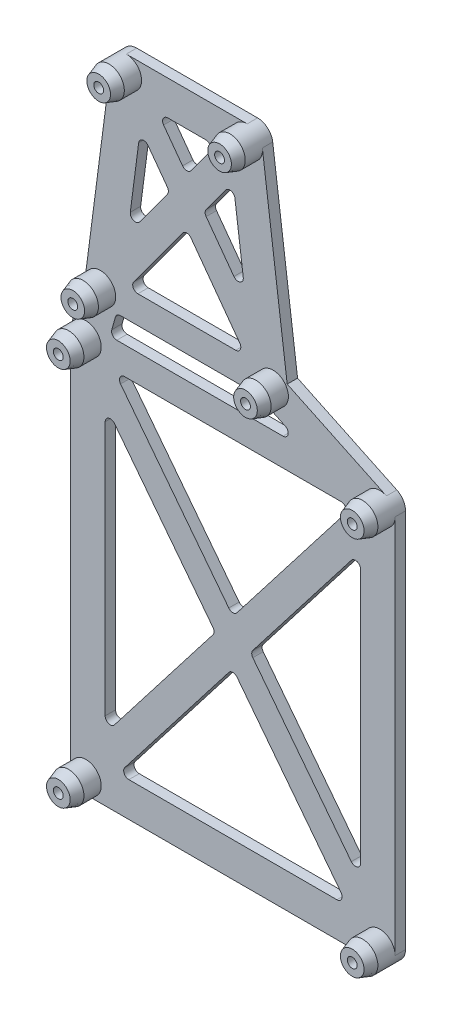
from build123d import *
from OCP.BRepFilletAPI import BRepFilletAPI_MakeChamfer

# Parameters (mm, degrees)
BOSS_EXTRUDE1_START       = -3
BOSS_EXTRUDE1_OUTLINE_R   = 1.425
BOSS_EXTRUDE1_DEPTH       = 3
CUT_EXTRUDE1_DEPTH        = 141.259282224
FILLET1_R                 = 5
BOSS_EXTRUDE2_START       = -3
BOSS_EXTRUDE2_DEPTH       = 3
BOSS_EXTRUDE3_OUTLINE_R   = 4.425
BOSS_EXTRUDE3_OUTLINE_R_2 = 1.425
BOSS_EXTRUDE3_DEPTH       = 8
CHAMFER1_SIZE             = 3
CHAMFER1_SIZE2            = 1
FILLET2_R                 = 1.5


with BuildPart() as part:
    # Boss-Extrude1: read off the stored shape, not the designer's step
    # Boss-Extrude1 outline → Boss-Extrude1 (new body)
    with BuildSketch(Plane.XY.offset(BOSS_EXTRUDE1_START)):
        with BuildLine():
            Line((46.975, -55), (46.975, 55))
            ThreePointArc((46.975, 55), (46.291006282, 57.363365609), (44.450481582, 58.996097441))
            Line((44.450481582, 58.996097441), (15.719744672, 72.659987561))
            Line((15.719744672, 72.659987561), (8.529121486, 128.267473535))
            ThreePointArc((8.529121486, 128.267473535), (7.062093597, 131.023529403), (4.140659479, 132.125))
            Line((4.140659479, 132.125), (-30.859340521, 132.125))
            ThreePointArc((-30.859340521, 132.125), (-33.988288028, 130.828947507), (-35.284340521, 127.7))
            Line((-35.284340521, 127.7), (-42.705029635, 70.596624539))
            Line((-42.705029635, 70.596624539), (-46.805456987, 56.213140895))
            ThreePointArc((-46.805456987, 56.213140895), (-46.932409278, 55.612465441), (-46.975, 55))
            Line((-46.975, 55), (-46.975, -55))
            ThreePointArc((-46.975, -55), (-45.678947507, -58.128947507), (-42.55, -59.425))
            Line((-42.55, -59.425), (42.55, -59.425))
            ThreePointArc((42.55, -59.425), (45.678947507, -58.128947507), (46.975, -55))
        make_face()
        with Locations((-42.55, -55)):
            Circle(BOSS_EXTRUDE1_OUTLINE_R, mode=Mode.SUBTRACT)
        with Locations((42.55, -55)):
            Circle(BOSS_EXTRUDE1_OUTLINE_R, mode=Mode.SUBTRACT)
        with Locations((-42.55, 55)):
            Circle(BOSS_EXTRUDE1_OUTLINE_R, mode=Mode.SUBTRACT)
        with Locations((-38.359340521, 69.7)):
            Circle(BOSS_EXTRUDE1_OUTLINE_R, mode=Mode.SUBTRACT)
        with Locations((-30.859340521, 127.7)):
            Circle(BOSS_EXTRUDE1_OUTLINE_R, mode=Mode.SUBTRACT)
        with Locations((11.640659479, 69.7)):
            Circle(BOSS_EXTRUDE1_OUTLINE_R, mode=Mode.SUBTRACT)
        with Locations((42.55, 55)):
            Circle(BOSS_EXTRUDE1_OUTLINE_R, mode=Mode.SUBTRACT)
        with Locations((4.140659479, 127.7)):
            Circle(BOSS_EXTRUDE1_OUTLINE_R, mode=Mode.SUBTRACT)
    extrude(amount=BOSS_EXTRUDE1_DEPTH)

    # Sketch2 → Cut-Extrude1 (cut, through all)
    with BuildSketch(Plane.XY):
        Polygon((36.975, -49.425), (36.975, 51.478016268), (6.501473049, 65.970750135), (-0.759852365, 122.125), (-25.924738161, 122.125), (-32.884263276, 68.570354395), (-36.975, 54.220863544), (-36.975, -49.425), align=None)
    extrude(amount=-CUT_EXTRUDE1_DEPTH, mode=Mode.SUBTRACT)

    # Fillet1
    fillet1_edges = [part.edges().sort_by_distance(p)[0] for p in [
        (36.975, -49.425, -1.5),
        (-36.975, -49.425, -1.5),
        (-36.975, 54.220863544, -1.5),
        (-32.884263276, 68.570354395, -1.5),
        (-25.924738161, 122.125, -1.5),
        (-0.759852365, 122.125, -1.5),
        (6.501473049, 65.970750135, -1.5),
        (36.975, 51.478016268, -1.5),
    ]]
    fillet(fillet1_edges, radius=FILLET1_R)

    # Sketch3 → Boss-Extrude2 (add)
    with BuildSketch(Plane.XY.offset(BOSS_EXTRUDE2_START)):
        with BuildLine():
            Line((-13.359340521, 110.585124752), (-8.400412901, 103.817647059))
            Line((-8.400412901, 103.817647059), (0.106294158, 115.426800222))
            Line((0.106294158, 115.426800222), (-0.196216119, 117.766213034))
            ThreePointArc((-0.196216119, 117.766213034), (-1.762074631, 120.797673514), (-4.907872753, 122.118892529))
            Line((-4.907872753, 122.118892529), (-13.359340521, 110.585124752))
        make_face()
        Polygon((-18.318268141, 103.817647059), (-13.359340521, 97.050169366), (-8.400412901, 103.817647059), (-13.359340521, 110.585124752), align=None)
        Polygon((-30.456475647, 87.252563875), (-32.217656355, 73.7), (-30.469378419, 73.7), (-13.359340521, 97.050169366), (-18.318268141, 103.817647059), align=None)
        with BuildLine():
            Line((-26.490764046, 117.769341361), (-26.799669466, 115.392265338))
            Line((-26.799669466, 115.392265338), (-18.318268141, 103.817647059))
            Line((-18.318268141, 103.817647059), (-13.359340521, 110.585124752))
            Line((-13.359340521, 110.585124752), (-21.809649014, 122.117310459))
            ThreePointArc((-21.809649014, 122.117310459), (-24.935223371, 120.788491562), (-26.490764046, 117.769341361))
        make_face()
        Polygon((3.750697376, 73.7), (5.502001083, 73.7), (3.752025755, 87.233142539), (-8.400412901, 103.817647059), (-13.359340521, 97.050169366), align=None)
        Polygon((-32.217656355, 73.7), (-32.594546524, 70.799770586), (-30.469378419, 73.7), align=None)
        with BuildLine():
            Line((-32.986220482, 68.212708794), (-33.702540681, 65.7))
            Line((-33.702540681, 65.7), (7.656754768, 65.7))
            ThreePointArc((7.656754768, 65.7), (6.649193532, 67.057986899), (6.151894728, 68.674155814))
            Line((6.151894728, 68.674155814), (5.877280449, 70.797839571))
            Line((5.877280449, 70.797839571), (3.750697376, 73.7))
            Line((3.750697376, 73.7), (-30.469378419, 73.7))
            Line((-30.469378419, 73.7), (-32.594546524, 70.799770586))
            Line((-32.594546524, 70.799770586), (-32.836337852, 68.939148105))
            ThreePointArc((-32.836337852, 68.939148105), (-32.897789852, 68.573145266), (-32.986220482, 68.212708794))
        make_face()
        Polygon((3.750697376, 73.7), (5.877280449, 70.797839571), (5.502001083, 73.7), align=None)
        with BuildLine():
            ThreePointArc((-36.783425974, 54.892867127), (-36.862088643, 54.578668017), (-36.920243348, 54.260035115))
            Line((-36.920243348, 54.260035115), (-34.398161636, 51))
            Line((-34.398161636, 51), (34.398161636, 51))
            Line((34.398161636, 51), (35.248308123, 52.098896751))
            ThreePointArc((35.248308123, 52.098896751), (34.710224384, 52.504802867), (34.122436816, 52.834650803))
            Line((34.122436816, 52.834650803), (21.158703634, 59))
            Line((21.158703634, 59), (-35.61256915, 59))
            Line((-35.61256915, 59), (-36.783425974, 54.892867127))
        make_face()
        with BuildLine():
            Line((36.195636792, 51), (34.398161636, 51))
            Line((34.398161636, 51), (0, 6.537041363))
            Line((0, 6.537041363), (5.057292909, 0))
            Line((5.057292909, 0), (36.975, 41.25673067))
            Line((36.975, 41.25673067), (36.975, 48.319286463))
            ThreePointArc((36.975, 48.319286463), (36.776207346, 49.71514033), (36.195636792, 51))
        make_face()
        Polygon((-34.398161636, 51), (-36.975, 51), (-36.975, 41.25673067), (-5.057292909, 0), (0, 6.537041363), align=None)
        with BuildLine():
            ThreePointArc((-36.920243348, 54.260035115), (-36.961292046, 53.892075142), (-36.975, 53.522086454))
            Line((-36.975, 53.522086454), (-36.975, 51))
            Line((-36.975, 51), (-34.398161636, 51))
            Line((-34.398161636, 51), (-36.920243348, 54.260035115))
        make_face()
        with BuildLine():
            Line((35.248308123, 52.098896751), (34.398161636, 51))
            Line((34.398161636, 51), (36.195636792, 51))
            ThreePointArc((36.195636792, 51), (35.762043189, 51.583992251), (35.248308123, 52.098896751))
        make_face()
        with BuildLine():
            Line((5.057292909, 0), (0, -6.537041363))
            Line((0, -6.537041363), (33.08343567, -49.300589233))
            ThreePointArc((33.08343567, -49.300589233), (35.882824097, -47.544120201), (36.975, -44.425))
            Line((36.975, -44.425), (36.975, -41.25673067))
            Line((36.975, -41.25673067), (5.057292909, 0))
        make_face()
        with BuildLine():
            Line((-5.057292909, 0), (-36.975, -41.25673067))
            Line((-36.975, -41.25673067), (-36.975, -44.425))
            ThreePointArc((-36.975, -44.425), (-35.882824097, -47.544120201), (-33.08343567, -49.300589233))
            Line((-33.08343567, -49.300589233), (0, -6.537041363))
            Line((0, -6.537041363), (-5.057292909, 0))
        make_face()
        Polygon((0, 6.537041363), (-5.057292909, 0), (0, -6.537041363), (5.057292909, 0), align=None)
    extrude(amount=BOSS_EXTRUDE2_DEPTH)

    # Boss-Extrude3: read off the stored shape, not the designer's step
    # Boss-Extrude3 outline → Boss-Extrude3 (add)
    # profile 1 of 8: a face of its own
    with BuildSketch(Plane.XY):
        with Locations((42.55, -55)):
            Circle(BOSS_EXTRUDE3_OUTLINE_R)
        with Locations((42.55, -55)):
            Circle(BOSS_EXTRUDE3_OUTLINE_R_2, mode=Mode.SUBTRACT)
    # profile 2 of 8: a face of its own
    with BuildSketch(Plane.XY):
        with Locations((-42.55, -55)):
            Circle(BOSS_EXTRUDE3_OUTLINE_R)
        with Locations((-42.55, -55)):
            Circle(BOSS_EXTRUDE3_OUTLINE_R_2, mode=Mode.SUBTRACT)
    # profile 3 of 8: a face of its own
    with BuildSketch(Plane.XY):
        with Locations((-42.55, 55)):
            Circle(BOSS_EXTRUDE3_OUTLINE_R)
        with Locations((-42.55, 55)):
            Circle(BOSS_EXTRUDE3_OUTLINE_R_2, mode=Mode.SUBTRACT)
    # profile 4 of 8: a face of its own
    with BuildSketch(Plane.XY):
        with Locations((-30.859340521, 127.7)):
            Circle(BOSS_EXTRUDE3_OUTLINE_R)
        with Locations((-30.859340521, 127.7)):
            Circle(BOSS_EXTRUDE3_OUTLINE_R_2, mode=Mode.SUBTRACT)
    # profile 5 of 8: a face of its own
    with BuildSketch(Plane.XY):
        with Locations((4.140659479, 127.7)):
            Circle(BOSS_EXTRUDE3_OUTLINE_R)
        with Locations((4.140659479, 127.7)):
            Circle(BOSS_EXTRUDE3_OUTLINE_R_2, mode=Mode.SUBTRACT)
    # profile 6 of 8: a face of its own
    with BuildSketch(Plane.XY):
        with Locations((42.55, 55)):
            Circle(BOSS_EXTRUDE3_OUTLINE_R)
        with Locations((42.55, 55)):
            Circle(BOSS_EXTRUDE3_OUTLINE_R_2, mode=Mode.SUBTRACT)
    # profile 7 of 8: a face of its own
    with BuildSketch(Plane.XY):
        with Locations((11.640659479, 69.7)):
            Circle(BOSS_EXTRUDE3_OUTLINE_R)
        with Locations((11.640659479, 69.7)):
            Circle(BOSS_EXTRUDE3_OUTLINE_R_2, mode=Mode.SUBTRACT)
    # profile 8 of 8: a face of its own
    with BuildSketch(Plane.XY):
        with Locations((-38.359340521, 69.7)):
            Circle(BOSS_EXTRUDE3_OUTLINE_R)
        with Locations((-38.359340521, 69.7)):
            Circle(BOSS_EXTRUDE3_OUTLINE_R_2, mode=Mode.SUBTRACT)
    extrude(amount=BOSS_EXTRUDE3_DEPTH)

    # Chamfer1: one chamfer whose edges measure the first distance from different faces: ONE call of the kernel's chamfer builder (chamfer() names one face for all edges)
    chamfer1_edges_1 = [part.edges().sort_by_distance(p)[0] for p in [
        (-35.284340521, 127.7, 8),
    ]]
    chamfer1_side_1 = [part.faces().sort_by_distance(p)[0] for p in [
        (-35.284340521, 127.7, 4),
    ]]
    chamfer1_edges_2 = [part.edges().sort_by_distance(p)[0] for p in [
        (-0.284340521, 127.7, 8),
    ]]
    chamfer1_side_2 = [part.faces().sort_by_distance(p)[0] for p in [
        (-0.284340521, 127.7, 4),
    ]]
    chamfer1_edges_3 = [part.edges().sort_by_distance(p)[0] for p in [
        (7.215659479, 69.7, 8),
    ]]
    chamfer1_side_3 = [part.faces().sort_by_distance(p)[0] for p in [
        (7.215659479, 69.7, 4),
    ]]
    chamfer1_edges_4 = [part.edges().sort_by_distance(p)[0] for p in [
        (-42.784340521, 69.7, 8),
    ]]
    chamfer1_side_4 = [part.faces().sort_by_distance(p)[0] for p in [
        (-42.784340521, 69.7, 4),
    ]]
    chamfer1_edges_5 = [part.edges().sort_by_distance(p)[0] for p in [
        (-46.975, 55, 8),
    ]]
    chamfer1_side_5 = [part.faces().sort_by_distance(p)[0] for p in [
        (-46.975, 55, 4),
    ]]
    chamfer1_edges_6 = [part.edges().sort_by_distance(p)[0] for p in [
        (38.125, 55, 8),
    ]]
    chamfer1_side_6 = [part.faces().sort_by_distance(p)[0] for p in [
        (38.125, 55, 4),
    ]]
    chamfer1_edges_7 = [part.edges().sort_by_distance(p)[0] for p in [
        (38.125, -55, 8),
    ]]
    chamfer1_side_7 = [part.faces().sort_by_distance(p)[0] for p in [
        (38.125, -55.000000001, 4),
    ]]
    chamfer1_edges_8 = [part.edges().sort_by_distance(p)[0] for p in [
        (-46.975, -55, 8),
    ]]
    chamfer1_side_8 = [part.faces().sort_by_distance(p)[0] for p in [
        (-46.975, -55, 4),
    ]]
    chamfer1 = BRepFilletAPI_MakeChamfer(part.part.solid().wrapped)
    for e in chamfer1_edges_1:
        chamfer1.Add(CHAMFER1_SIZE, CHAMFER1_SIZE2, e.wrapped, chamfer1_side_1[0].wrapped)  # the first distance lies on this face
    for e in chamfer1_edges_2:
        chamfer1.Add(CHAMFER1_SIZE, CHAMFER1_SIZE2, e.wrapped, chamfer1_side_2[0].wrapped)  # the first distance lies on this face
    for e in chamfer1_edges_3:
        chamfer1.Add(CHAMFER1_SIZE, CHAMFER1_SIZE2, e.wrapped, chamfer1_side_3[0].wrapped)  # the first distance lies on this face
    for e in chamfer1_edges_4:
        chamfer1.Add(CHAMFER1_SIZE, CHAMFER1_SIZE2, e.wrapped, chamfer1_side_4[0].wrapped)  # the first distance lies on this face
    for e in chamfer1_edges_5:
        chamfer1.Add(CHAMFER1_SIZE, CHAMFER1_SIZE2, e.wrapped, chamfer1_side_5[0].wrapped)  # the first distance lies on this face
    for e in chamfer1_edges_6:
        chamfer1.Add(CHAMFER1_SIZE, CHAMFER1_SIZE2, e.wrapped, chamfer1_side_6[0].wrapped)  # the first distance lies on this face
    for e in chamfer1_edges_7:
        chamfer1.Add(CHAMFER1_SIZE, CHAMFER1_SIZE2, e.wrapped, chamfer1_side_7[0].wrapped)  # the first distance lies on this face
    for e in chamfer1_edges_8:
        chamfer1.Add(CHAMFER1_SIZE, CHAMFER1_SIZE2, e.wrapped, chamfer1_side_8[0].wrapped)  # the first distance lies on this face
    add(Compound.cast(chamfer1.Shape()), mode=Mode.REPLACE)

    # Fillet2
    # the kernel refuses this fillet: 1.5 mm, written as the material it adds along each edge
    with BuildSketch(Plane(origin=(36.975, -41.25673067, -3), x_dir=(0, 1, 0), z_dir=(0, 0, 1)), Plane(origin=(-36.975, 41.25673067, -3), x_dir=(0, -1, 0), z_dir=(0, 0, 1))) as fillet2_piece_1:
        with BuildLine():
            CenterArc((FILLET2_R * 2.92685728561, FILLET2_R), FILLET2_R, 127.726839505, 142.273160495)
            Line((FILLET2_R * 2.31495967357, FILLET2_R * 1.79093698383), (0, 0))
            Line((0, 0), (FILLET2_R * 2.92685728561, 0))
        make_face()
    extrude(amount=3)
    with BuildSketch(Plane(origin=(33.08343567, -49.300589233, -3), x_dir=(-0.9991182911759181, -0.04198380923300266, 0), z_dir=(0, 0, 1))) as fillet2_piece_2:
        with BuildLine():
            CenterArc((2.90032775, -1.498677437), FILLET2_R, 87.593797692, 127.726839505)
            Line((1.676433649, -2.36590476), (1.554044239, -2.452627493))
            Line((1.554044239, -2.452627493), (-0.12238941, -0.086722732))
            Line((-0.12238941, -0.086722732), (-0.027082876, 0.147534802))
            ThreePointArc((-0.027082876, 0.147534802), (1.118979162, 0.227632465), (2.969601035, 0.149867744))
            Line((2.969601035, 0.149867744), (2.963303464, 0))
        make_face()
    extrude(amount=3)
    with BuildSketch(Plane(origin=(0, -6.537041363, -3), x_dir=(0.6118976120341761, -0.7909369838279613, 0), z_dir=(0, 0, 1)), Plane(origin=(0, 6.537041363, -3), x_dir=(-0.6118976120341769, 0.7909369838279607, 0), z_dir=(0, 0, 1))) as fillet2_piece_3:
        with BuildLine():
            CenterArc((FILLET2_R * 1.29259694477, -FILLET2_R), FILLET2_R, 90, 104.54632099)
            Line((FILLET2_R * 0.324652041423, -FILLET2_R * 1.25116262477), (0, 0))
            Line((0, 0), (FILLET2_R * 1.29259694477, 0))
        make_face()
    extrude(amount=3)
    with BuildSketch(Plane(origin=(-33.08343567, -49.300589233, -3), x_dir=(0.6118976120341917, 0.7909369838279493, 0), z_dir=(0, 0, 1))) as fillet2_piece_4:
        with BuildLine():
            CenterArc((2.899643964, -1.5), FILLET2_R, 90, 127.726839505)
            Line((1.713238488, -2.417846418), (1.59459794, -2.50963106))
            ThreePointArc((1.59459794, -2.50963106), (0.461207515, -1.044614059), (-0.136035989, -0.063199759))
            Line((-0.136035989, -0.063199759), (0, 0.15))
            Line((0, 0.15), (2.899643964, 0.15))
            Line((2.899643964, 0.15), (2.899643964, 0))
        make_face()
    extrude(amount=3)
    with BuildSketch(Plane(origin=(-36.975, -41.25673067, -3), x_dir=(0, 1, 0), z_dir=(0, 0, 1)), Plane(origin=(36.975, 41.25673067, -3), x_dir=(0, -1, 0), z_dir=(0, 0, 1))) as fillet2_piece_5:
        with BuildLine():
            CenterArc((FILLET2_R * 2.92685728561, -FILLET2_R), FILLET2_R, 90, 142.273160495)
            Line((FILLET2_R * 2.31495967357, -FILLET2_R * 1.79093698383), (0, 0))
            Line((0, 0), (FILLET2_R * 2.92685728561, 0))
        make_face()
    extrude(amount=3)
    with BuildSketch(Plane(origin=(-5.057292909, 0, -3), x_dir=(-0.6118976120341743, 0.7909369838279628, 0), z_dir=(0, 0, 1)), Plane(origin=(5.057292909, 0, -3), x_dir=(0.611897612034178, -0.7909369838279598, 0), z_dir=(0, 0, 1))) as fillet2_piece_6:
        with BuildLine():
            CenterArc((FILLET2_R * 0.773636363636, FILLET2_R), FILLET2_R, 194.54632099, 75.45367901)
            Line((-FILLET2_R * 0.194308539711, FILLET2_R * 0.748837375226), (0, 0))
            Line((0, 0), (FILLET2_R * 0.773636363636, 0))
        make_face()
    extrude(amount=3)
    with BuildSketch(Plane(origin=(-34.398161636, 51, -3), x_dir=(0.611897612034177, -0.7909369838279607, 0), z_dir=(0, 0, 1))) as fillet2_piece_7:
        with BuildLine():
            CenterArc((FILLET2_R * 2.03795959096, FILLET2_R), FILLET2_R, 142.273160495, 127.726839505)
            Line((FILLET2_R * 1.24702260713, FILLET2_R * 1.61189761203), (0, 0))
            Line((0, 0), (FILLET2_R * 2.03795959096, 0))
        make_face()
    extrude(amount=3)
    with BuildSketch(Plane(origin=(34.398161636, 51, -3), x_dir=(-0.6118976120341773, -0.7909369838279604, 0), z_dir=(0, 0, 1))) as fillet2_piece_8:
        with BuildLine():
            CenterArc((FILLET2_R * 2.03795959096, -FILLET2_R), FILLET2_R, 90, 127.726839505)
            Line((FILLET2_R * 1.24702260713, -FILLET2_R * 1.61189761203), (0, 0))
            Line((0, 0), (FILLET2_R * 2.03795959096, 0))
        make_face()
    extrude(amount=3)
    with BuildSketch(Plane(origin=(21.158703634, 59, -3), x_dir=(-0.9030728679592901, 0.4294873632084912, 0), z_dir=(0, 0, 1))) as fillet2_piece_9:
        with BuildLine():
            CenterArc((FILLET2_R * 4.43103343889, FILLET2_R), FILLET2_R, 115.435031326, 154.564968674)
            Line((FILLET2_R * 4.00154607569, FILLET2_R * 1.90307286796), (0, 0))
            Line((0, 0), (FILLET2_R * 4.43103343889, 0))
        make_face()
    extrude(amount=3)
    with BuildSketch(Plane(origin=(7.656754768, 65.7, -3), x_dir=(0.7559277616775966, -0.6546550382645037, 0), z_dir=(0, 0, 1))) as fillet2_piece_10:
        with BuildLine():
            CenterArc((0.561302952, -1.498212199), FILLET2_R, 92.797658541, 38.095839762)
            Line((-0.420679605, -0.364320557), (0, 0))
            ThreePointArc((0, 0), (0.244044762, -0.005959336), (0.488089524, 0))
        make_face()
    extrude(amount=3)
    with BuildSketch(Plane(origin=(-35.61256915, 59, -3), x_dir=(1, 0, 0), z_dir=(0, 0, 1))) as fillet2_piece_11:
        with BuildLine():
            CenterArc((FILLET2_R * 1.32492019361, FILLET2_R), FILLET2_R, 164.08826839, 105.91173161)
            Line((FILLET2_R * 0.363234998803, FILLET2_R * 1.2741561345), (0, 0))
            Line((0, 0), (FILLET2_R * 1.32492019361, 0))
        make_face()
    extrude(amount=3)
    with BuildSketch(Plane(origin=(-33.702540681, 65.7, -3), x_dir=(-0.274156134500953, -0.961685194809349, 0), z_dir=(0, 0, 1))) as fillet2_piece_12:
        with BuildLine():
            CenterArc((FILLET2_R * 0.754762441407, FILLET2_R), FILLET2_R, 195.91173161, 74.08826839)
            Line((-FILLET2_R * 0.206922753403, FILLET2_R * 0.725843865499), (0, 0))
            Line((0, 0), (FILLET2_R * 0.754762441407, 0))
        make_face()
    extrude(amount=3)
    with BuildSketch(Plane(origin=(-30.469378419, 73.7, -3), x_dir=(1, 0, 0), z_dir=(0, 0, 1))) as fillet2_piece_13:
        with BuildLine():
            CenterArc((FILLET2_R * 1.97249052566, FILLET2_R), FILLET2_R, 143.767581245, 126.232418755)
            Line((FILLET2_R * 1.16586451564, FILLET2_R * 1.59106216252), (0, 0))
            Line((0, 0), (FILLET2_R * 1.97249052566, 0))
        make_face()
    extrude(amount=3)
    with BuildSketch(Plane(origin=(3.750697376, 73.7, -3), x_dir=(-1, 0, 0), z_dir=(0, 0, 1))) as fillet2_piece_14:
        with BuildLine():
            CenterArc((FILLET2_R * 1.97249052566, -FILLET2_R), FILLET2_R, 90, 126.232418755)
            Line((FILLET2_R * 1.16586451564, -FILLET2_R * 1.59106216252), (0, 0))
            Line((0, 0), (FILLET2_R * 1.97249052566, 0))
        make_face()
    extrude(amount=3)
    with BuildSketch(Plane(origin=(-13.359340521, 97.050169366, -3), x_dir=(0.5910621625154567, -0.8066260100210951, 0), z_dir=(0, 0, 1))) as fillet2_piece_15:
        with BuildLine():
            CenterArc((FILLET2_R * 1.36470588235, -FILLET2_R), FILLET2_R, 90, 107.535162489)
            Line((FILLET2_R * 0.411173654704, -FILLET2_R * 1.30129104009), (0, 0))
            Line((0, 0), (FILLET2_R * 1.36470588235, 0))
        make_face()
    extrude(amount=3)
    with BuildSketch(Plane(origin=(3.752025755, 87.233142539, -3), x_dir=(-0.12824260686651673, 0.9917428264343937, 0), z_dir=(0, 0, 1))) as fillet2_piece_16:
        with BuildLine():
            CenterArc((FILLET2_R * 3.88568031429, FILLET2_R), FILLET2_R, 118.864367684, 151.135632316)
            Line((FILLET2_R * 3.40294247693, FILLET2_R * 1.87576491159), (0, 0))
            Line((0, 0), (FILLET2_R * 3.88568031429, 0))
        make_face()
    extrude(amount=3)
    with BuildSketch(Plane(origin=(-8.400412901, 103.817647059, -3), x_dir=(0.5910621625154552, -0.8066260100210961, 0), z_dir=(0, 0, 1)), Plane(origin=(-18.318268141, 103.817647059, -3), x_dir=(-0.5910621625154587, 0.8066260100210937, 0), z_dir=(0, 0, 1))) as fillet2_piece_17:
        with BuildLine():
            CenterArc((FILLET2_R * 0.73275862069, FILLET2_R), FILLET2_R, 197.535162489, 72.464837511)
            Line((-FILLET2_R * 0.220773606959, FILLET2_R * 0.698708959915), (0, 0))
            Line((0, 0), (FILLET2_R * 0.73275862069, 0))
        make_face()
    extrude(amount=3)
    with BuildSketch(Plane(origin=(0.106294158, 115.426800222, -3), x_dir=(0.12824260686651523, -0.991742826434394, 0), z_dir=(0, 0, 1))) as fillet2_piece_18:
        with BuildLine():
            CenterArc((FILLET2_R * 2.5001486338, -FILLET2_R), FILLET2_R, 90, 136.399530173)
            Line((FILLET2_R * 1.81052315186, -FILLET2_R * 1.72416620651), (0, 0))
            Line((0, 0), (FILLET2_R * 2.5001486338, 0))
        make_face()
    extrude(amount=3)
    with BuildSketch(Plane(origin=(-30.456475647, 87.252563875, -3), x_dir=(0.1288682722639774, 0.9916617207514351, 0), z_dir=(0, 0, 1))) as fillet2_piece_19:
        with BuildLine():
            CenterArc((FILLET2_R * 3.89076482555, -FILLET2_R), FILLET2_R, 90, 151.171780247)
            Line((FILLET2_R * 3.40857960467, -FILLET2_R * 1.87606929678), (0, 0))
            Line((0, 0), (FILLET2_R * 3.89076482555, 0))
        make_face()
    extrude(amount=3)
    with BuildSketch(Plane(origin=(-26.799669466, 115.392265338, -3), x_dir=(-0.12886827226397635, -0.9916617207514352, 0), z_dir=(0, 0, 1))) as fillet2_piece_20:
        with BuildLine():
            CenterArc((FILLET2_R * 2.49786318774, FILLET2_R), FILLET2_R, 133.636617758, 136.363382242)
            Line((FILLET2_R * 1.80778096632, FILLET2_R * 1.72373097742), (0, 0))
            Line((0, 0), (FILLET2_R * 2.49786318774, 0))
        make_face()
    extrude(amount=3)
    with BuildSketch(Plane(origin=(-13.359340521, 110.585124752, -3), x_dir=(0.5910621625154566, 0.8066260100210952, 0), z_dir=(0, 0, 1))) as fillet2_piece_21:
        with BuildLine():
            CenterArc((FILLET2_R * 1.36470588235, FILLET2_R), FILLET2_R, 162.464837511, 107.535162489)
            Line((FILLET2_R * 0.411173654704, FILLET2_R * 1.30129104009), (0, 0))
            Line((0, 0), (FILLET2_R * 1.36470588235, 0))
        make_face()
    extrude(amount=3)
    with BuildSketch(Plane(origin=(-4.907872753, 122.118892529, -3), x_dir=(-0.9999978630525282, 0.0020673389603159615, 0), z_dir=(0, 0, 1))) as fillet2_piece_22:
        with BuildLine():
            CenterArc((2.951165791, 1.499996795), FILLET2_R, 143.886031126, 126.232418755)
            Line((1.739396473, 2.38408679), (1.618219541, 2.472495789))
            Line((1.618219541, 2.472495789), (-0.121176932, 0.088409))
            Line((-0.121176932, 0.088409), (-0.007101987, -0.149831778))
            ThreePointArc((-0.007101987, -0.149831778), (0.247379697, -0.155596386), (2.954576901, -0.149999679))
            Line((2.954576901, -0.149999679), (2.9542668, 0))
        make_face()
    extrude(amount=3)
    with BuildSketch(Plane(origin=(-21.809649014, 122.117310459, -3), x_dir=(0.5910621625154486, -0.806626010021101, 0), z_dir=(0, 0, 1))) as fillet2_piece_23:
        with BuildLine():
            CenterArc((2.94920282, 1.5), FILLET2_R, 143.767581245, 126.232418755)
            Line((1.739263805, 2.386593244), (1.618269903, 2.475252568))
            ThreePointArc((1.618269903, 2.475252568), (0.036642147, 0.316795865), (-0.125722983, 0.081815228))
            Line((-0.125722983, 0.081815228), (0, -0.15))
            Line((0, -0.15), (2.94920282, -0.15))
            Line((2.94920282, -0.15), (2.94920282, 0))
        make_face()
    extrude(amount=3)


solid = part.part
